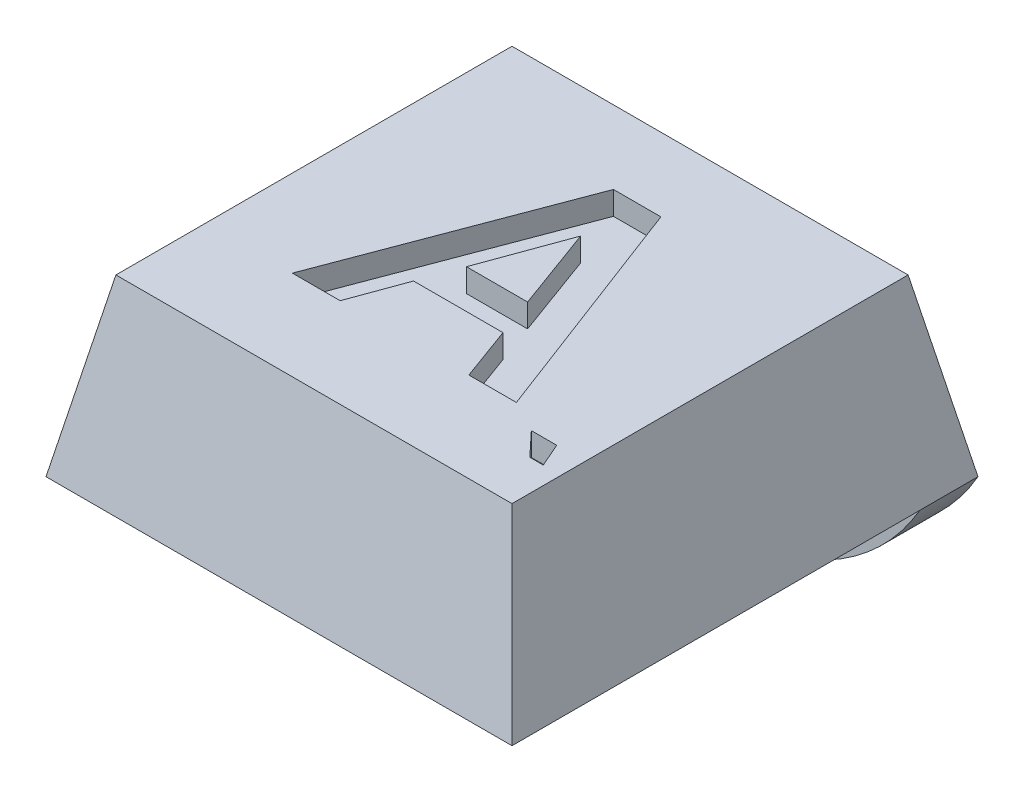
from build123d import *

# Parameters (mm, degrees)
SKETCH1_W               = 8
SKETCH1_H               = 8
BOSS_EXTRUDE1_DEPTH     = 3
CUT_EXTRUDE1_DEPTH      = 12.704699911
CUT_EXTRUDE1_DEPTH_BACK = 12.704699911
CUT_EXTRUDE2_DEPTH      = 11
SKETCH4_R               = 1.8
CUT_EXTRUDE3_DEPTH      = 0.8
SKETCH5_W               = 8
SKETCH5_H               = 1
BOSS_EXTRUDE2_DEPTH     = 2
FILLET1_R               = 4
CUT_EXTRUDE4_DEPTH      = 0.4
CUT_EXTRUDE5_DEPTH      = 0.4


with BuildPart() as part:
    # Sketch1 → Boss-Extrude1 (new body)
    with BuildSketch(Plane(origin=(0, 0, 0), x_dir=(1, 0, 0), z_dir=(0, 1, 0))):
        with Locations((4, 4)):
            Rectangle(SKETCH1_W, SKETCH1_H)
    extrude(amount=BOSS_EXTRUDE1_DEPTH)

    # Sketch2 → Cut-Extrude1 (cut, two sides: drawn at the far end of the back side and taken through both)
    with BuildSketch(Plane.XY.offset(-CUT_EXTRUDE1_DEPTH_BACK)):
        Polygon((0, 0), (0.6, 3), (0, 3), align=None)
        Polygon((8, 0), (7.4, 3), (8, 3), align=None)
    extrude(amount=CUT_EXTRUDE1_DEPTH + CUT_EXTRUDE1_DEPTH_BACK, mode=Mode.SUBTRACT)

    # Sketch3 → Cut-Extrude2 (cut)
    with BuildSketch(Plane(origin=(0, 0, 0), x_dir=(0, 0, -1), z_dir=(1, 0, 0))):
        Polygon((0, 0), (0.6, 3), (0, 3), align=None)
        Polygon((8, 3), (7.4, 3), (8, 0), align=None)
    extrude(amount=CUT_EXTRUDE2_DEPTH, mode=Mode.SUBTRACT)

    # Sketch4 → Cut-Extrude3 (cut)
    with BuildSketch(Plane.XZ):
        with Locations(Location((4, -3.75, 0), (0, 0, 270))):
            Circle(SKETCH4_R)
    extrude(amount=-CUT_EXTRUDE3_DEPTH, mode=Mode.SUBTRACT)

    # Sketch5 → Boss-Extrude2 (add)
    with BuildSketch(Plane.XZ):
        with Locations((4, -7.5)):
            Rectangle(SKETCH5_W, SKETCH5_H)
    extrude(amount=BOSS_EXTRUDE2_DEPTH)

    # Fillet1
    # the kernel refuses this fillet: 4 mm, written as the material it takes off along each edge
    with BuildSketch(Plane(origin=(8, -2, -16.660254038), x_dir=(0, 1, 0), z_dir=(0, 0, 1)), Plane(origin=(0, -2, 1.660254038), x_dir=(0, 1, 0), z_dir=(0, 0, -1))) as fillet1_piece_1:
        with BuildLine():
            CenterArc((4, 3.464101615), FILLET1_R, 180, 60)
            Line((0, 3.464101615), (-0.08, 3.464101615))
            Line((-0.08, 3.464101615), (-0.08, 0))
            Line((-0.08, 0), (0, -0.08))
            ThreePointArc((0, -0.08), (1, -0.08), (1.96, -0.069282032))
            Line((1.96, -0.069282032), (2, 0))
        make_face()
    extrude(amount=18.320508076, mode=Mode.SUBTRACT)

    # Sketch6 → Cut-Extrude4 (cut)
    with BuildSketch(Plane(origin=(0, 3, 0), x_dir=(1, 0, 0), z_dir=(0, 1, 0))):
        Polygon((5.933857302, 2.141652068), (5.118152174, 2.141652068), (4.780812431, 3.064728992), (3.24555602, 3.064728992), (2.908216277, 2.141652068), (2.087703456, 2.141652068), (3.599722687, 6.141652068), (4.414626533, 6.141652068), align=None)
        Polygon((4.536421405, 3.731395658), (4.010780379, 5.167293094), (3.486741918, 3.731395658), align=None, mode=Mode.SUBTRACT)
    extrude(amount=-CUT_EXTRUDE4_DEPTH, mode=Mode.SUBTRACT)

    # Sketch7 → Cut-Extrude5 (cut)
    with BuildSketch(Plane(origin=(0, 3, 0), x_dir=(1, 0, 0), z_dir=(0, 1, 0))):
        Polygon((7.095591712, 1.44126633), (6.864822481, 1.44126633), (6.480207097, 1.85152274), (6.916104533, 1.85152274), align=None)
    extrude(amount=-CUT_EXTRUDE5_DEPTH, mode=Mode.SUBTRACT)


solid = part.part
